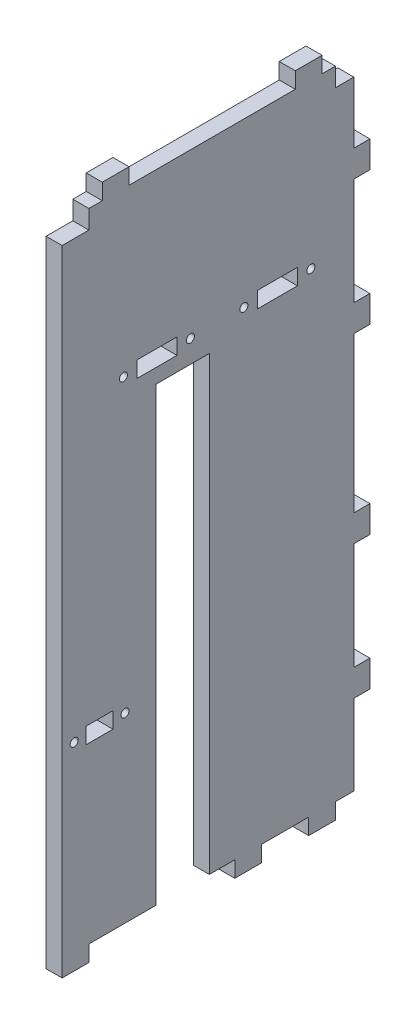
from build123d import *

# Parameters (mm, degrees)
ESQUISSE1_W             = 109
ESQUISSE1_H             = 238
ESQUISSE1_W_2           = 10
ESQUISSE1_H_2           = 6
ESQUISSE1_W_3           = 15
BOSS_EXTRU_1_DEPTH      = 6
ESQUISSE3_W             = 10
ESQUISSE3_H             = 6
ESQUISSE3_W_2           = 6
ESQUISSE3_H_2           = 10
BOSS_EXTRU_5_DEPTH      = 6
ESQUISSE6_W             = 20
ESQUISSE6_H             = 168.59
ENL_V_MAT_EXTRU_2_DEPTH = 6
ESQUISSE7_W             = 6.88
ESQUISSE7_H             = 7
ENL_V_MAT_EXTRU_3_DEPTH = 6
ESQUISSE8_R             = 1.5
ENL_V_MAT_EXTRU_4_DEPTH = 6
ESQUISSE9_W             = 10
ESQUISSE9_H             = 7
ENL_V_MAT_EXTRU_5_DEPTH = 6


with BuildPart() as part:
    # Esquisse1 → Boss.-Extru.1 (new body)
    with BuildSketch(Plane(origin=(0, 0, 0), x_dir=(0, 0, -1), z_dir=(1, 0, 0))):
        Rectangle(ESQUISSE1_W, ESQUISSE1_H)
        with Locations((-40.5, -51)):
            Rectangle(ESQUISSE1_W_2, ESQUISSE1_H_2, mode=Mode.SUBTRACT)
        with Locations((-19.085, 58)):
            Rectangle(ESQUISSE1_W_3, ESQUISSE1_H_2, mode=Mode.SUBTRACT)
        with Locations((25.915, 58)):
            Rectangle(ESQUISSE1_W_3, ESQUISSE1_H_2, mode=Mode.SUBTRACT)
    extrude(amount=BOSS_EXTRU_1_DEPTH)

    # Esquisse3 → Boss.-Extru.5 (add)
    with BuildSketch(Plane(origin=(6, 0, 0), x_dir=(0, 0, -1), z_dir=(1, 0, 0))):
        with Locations((-49.5, -122)):
            Rectangle(ESQUISSE3_W, ESQUISSE3_H)
        with Locations((42.62, -122)):
            Rectangle(ESQUISSE3_W, ESQUISSE3_H)
        with Locations((57.5, 34)):
            Rectangle(ESQUISSE3_W_2, ESQUISSE3_H_2)
        with Locations((57.5, 84)):
            Rectangle(ESQUISSE3_W_2, ESQUISSE3_H_2)
        with Locations((57.5, -84)):
            Rectangle(ESQUISSE3_W_2, ESQUISSE3_H_2)
        with Locations((57.5, -34)):
            Rectangle(ESQUISSE3_W_2, ESQUISSE3_H_2)
        with Locations((15, -122)):
            Rectangle(ESQUISSE3_W, ESQUISSE3_H)
        with Locations((37.62, 122)):
            Rectangle(ESQUISSE3_W, ESQUISSE3_H)
        with Locations((-34.5, 122)):
            Rectangle(ESQUISSE3_W, ESQUISSE3_H)
    extrude(amount=-BOSS_EXTRU_5_DEPTH)

    # Esquisse6 → Enlèv. mat.-Extru.2 (cut)
    with BuildSketch(Plane(origin=(6, 0, 0), x_dir=(0, 0, -1), z_dir=(1, 0, 0))):
        with Locations((-9.5, -34.705)):
            Rectangle(ESQUISSE6_W, ESQUISSE6_H)
    extrude(amount=-ENL_V_MAT_EXTRU_2_DEPTH, mode=Mode.SUBTRACT)

    # Esquisse7 → Enlèv. mat.-Extru.3 (cut)
    with BuildSketch(Plane.ZY):
        with Locations((-51.06, 115.5)):
            Rectangle(ESQUISSE7_W, ESQUISSE7_H)
    extrude(amount=-ENL_V_MAT_EXTRU_3_DEPTH, mode=Mode.SUBTRACT)

    # Esquisse8 → Enlèv. mat.-Extru.4 (cut)
    with BuildSketch(Plane.ZY):
        with Locations((-38.415, 58)):
            Circle(ESQUISSE8_R)
        with Locations((-13.415, 58)):
            Circle(ESQUISSE8_R)
        with Locations((6.585, 58)):
            Circle(ESQUISSE8_R)
        with Locations((31.585, 58)):
            Circle(ESQUISSE8_R)
        with Locations((31, -51)):
            Circle(ESQUISSE8_R)
        with Locations((50, -51)):
            Circle(ESQUISSE8_R)
    extrude(amount=-ENL_V_MAT_EXTRU_4_DEPTH, mode=Mode.SUBTRACT)

    # Esquisse9 → Enlèv. mat.-Extru.5 (cut)
    with BuildSketch(Plane.ZY):
        with Locations((49.5, 115.5)):
            Rectangle(ESQUISSE9_W, ESQUISSE9_H)
    extrude(amount=-ENL_V_MAT_EXTRU_5_DEPTH, mode=Mode.SUBTRACT)


solid = part.part
